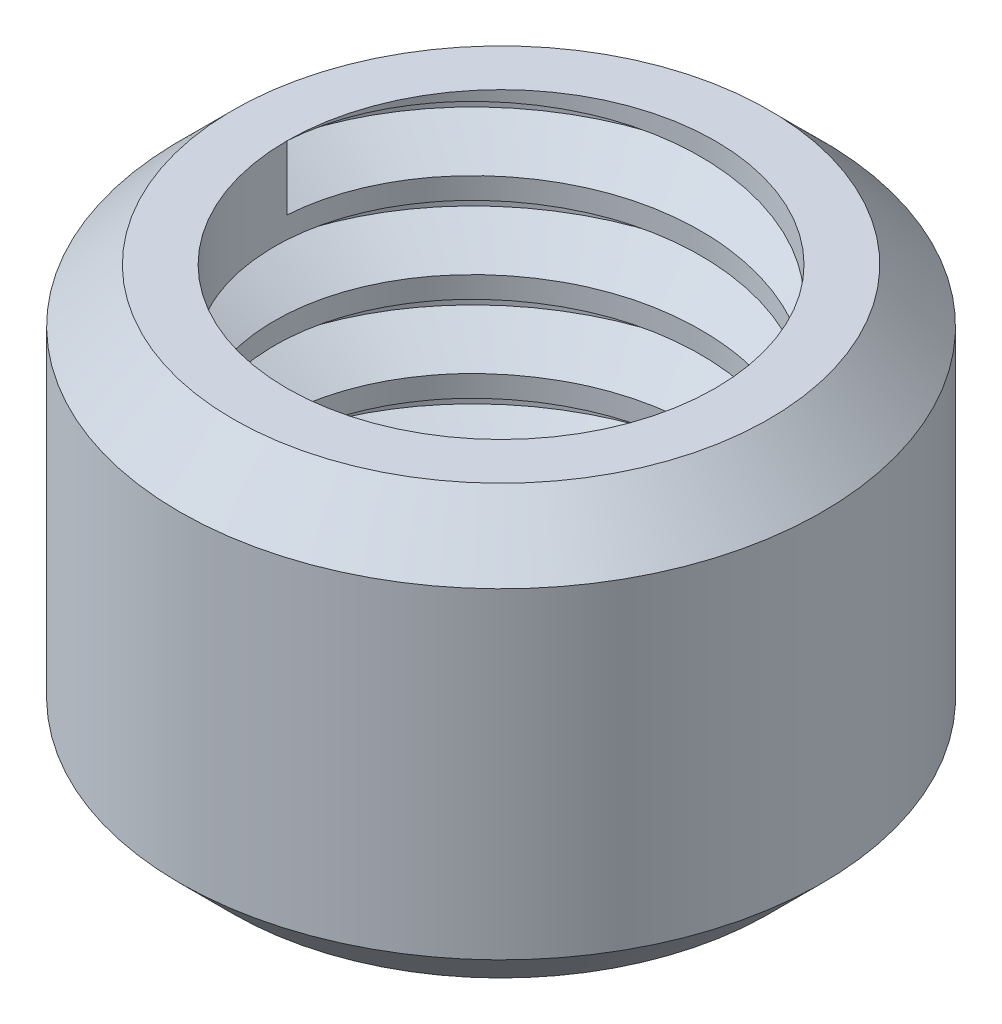
from build123d import *

# Parameters (mm, degrees)
SKETCH1_R           = 1.5
BOSS_EXTRUDE1_DEPTH = 2
SKETCH2_R           = 1
CUT_EXTRUDE1_DEPTH  = 3
THREAD1_PITCH       = 0.4
CHAMFER1_SIZE       = 0.25


with BuildPart() as part:
    # Sketch1 → Boss-Extrude1 (new body)
    with BuildSketch(Plane(origin=(0, 0, 0), x_dir=(1, 0, 0), z_dir=(0, 1, 0))):
        with Locations(Location((0, 0, 0), (0, 0, 270))):
            Circle(SKETCH1_R)
    extrude(amount=BOSS_EXTRUDE1_DEPTH)

    # Sketch2 → Cut-Extrude1 (cut)
    with BuildSketch(Plane(origin=(0, 2, 0), x_dir=(1, 0, 0), z_dir=(0, 1, 0))):
        with Locations(Location((0, 0, 0), (0, 0, 270))):
            Circle(SKETCH2_R)
    extrude(amount=-CUT_EXTRUDE1_DEPTH, mode=Mode.SUBTRACT)

    # Thread1: the profile of Thread Profile1 profile screwed along a right-hand helix of 25 turns, 6 arcs to a turn; built about Z, then put on its axis
    thread1_z = Axis((0, 0, 0), (0, 0, 1))
    thread1_corners = [(0.9997, 0, -0.000173205), (1.21650635, 0, 0.124999999), (1.21650635, 0, 0.174999999), (0.9997, 0, 0.300173204)]
    with BuildLine(mode=Mode.PRIVATE) as thread1_profile:
        Line(thread1_corners[0], thread1_corners[1])
        Line(thread1_corners[1], thread1_corners[2])
        Line(thread1_corners[2], thread1_corners[3])
        Line(thread1_corners[3], thread1_corners[0])
    thread1_cap = Face(thread1_profile.wire())
    thread1_turn_angles = [0, 30, 60, 90, 120, 150, 180, 210, 240, 270, 300, 330, 360]
    thread1_turn_weights = [1, 0.8660254037844387, 1, 0.8660254037844387, 1, 0.8660254037844387, 1, 0.8660254037844387, 1, 0.8660254037844387, 1, 0.8660254037844387, 1]
    thread1_turn_rails = [Edge.make_bspline([Vector(p[0], p[1], 0).rotate(thread1_z, thread1_turn_angles[k]) / thread1_turn_weights[k] + Vector(0, 0, p[2] + THREAD1_PITCH * thread1_turn_angles[k] / 360) for k in range(13)], [0, 0, 0, 1, 1, 2, 2, 3, 3, 4, 4, 5, 5, 6, 6, 6], 2, thread1_turn_weights) for p in thread1_corners]
    thread1_turn_sides = [Face.make_surface_from_curves(thread1_turn_rails[p[0]], thread1_turn_rails[p[1]]) for p in [(0, 1), (1, 2), (2, 3), (3, 0)]]
    thread1 = Plane(origin=(0, 2, 0), x_dir=(-1, 0, 0), z_dir=(0, -1, 0)) * Solid(Shell([*[p.moved(Location((0, 0, THREAD1_PITCH * i))) for i in range(25) for p in thread1_turn_sides], thread1_cap, thread1_cap.rotate(thread1_z, 9000).moved(Location((0, 0, THREAD1_PITCH * 9000 / 360)))]))
    add(thread1, mode=Mode.SUBTRACT)

    # Chamfer1
    chamfer1_edges = [part.edges().sort_by_distance(p)[0] for p in [
        (0, 0, -1.5),
        (0, 2, -1.5),
    ]]
    chamfer(chamfer1_edges, length=CHAMFER1_SIZE)


solid = part.part
